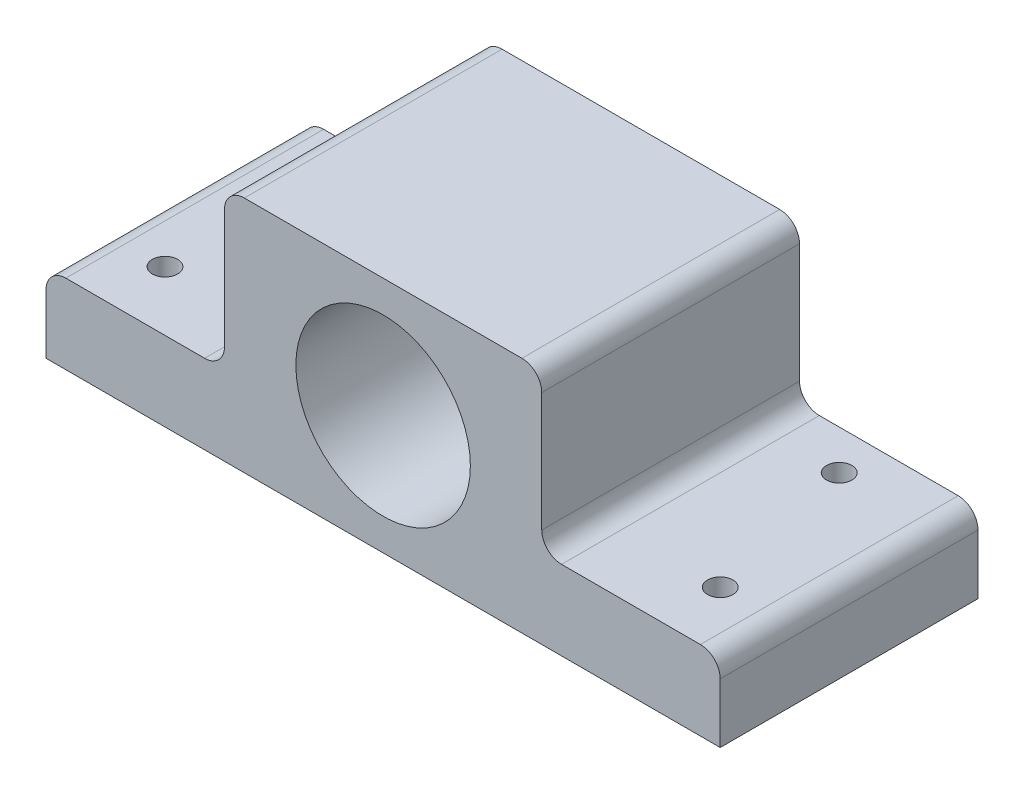
from build123d import *

# Parameters (mm, degrees)
BOSS_EXTRUDE1_DEPTH      = 15
BOSS_EXTRUDE1_DEPTH_BACK = 17.5
SKETCH2_R                = 11
CUT_EXTRUDE1_DEPTH       = 92.821838361
CUT_EXTRUDE1_DEPTH_BACK  = 92.821838361
SKETCH3_R                = 1.6
FILLET1_R                = 2.5


with BuildPart() as part:
    # Sketch2 → Boss-Extrude1 (new, two sides: drawn at the far end of the back side and taken through both)
    with BuildSketch(Plane.XY.offset(-BOSS_EXTRUDE1_DEPTH_BACK)):
        Polygon((0, 10), (0, 0), (85, 0), (85, 10), (62.5, 10), (62.5, 30), (22.5, 30), (22.5, 10), align=None)
        with Locations((42.5, 15)):
            Circle(SKETCH2_R, mode=Mode.SUBTRACT)
    extrude(amount=BOSS_EXTRUDE1_DEPTH + BOSS_EXTRUDE1_DEPTH_BACK)

    # Sketch3 → Cut-Extrude1 (cut, two sides: drawn at the far end of the back side and taken through both)
    with BuildSketch(Plane(origin=(0, 0, 0), x_dir=(1, 0, 0), z_dir=(0, 1, 0)).offset(-CUT_EXTRUDE1_DEPTH_BACK)):
        with Locations((7.5, -7.5)):
            Circle(SKETCH3_R)
        with Locations((77.5, -7.5)):
            Circle(SKETCH3_R)
        with Locations((72.5, 12.5)):
            Circle(SKETCH3_R)
        with Locations((12.5, 12.5)):
            Circle(SKETCH3_R)
    extrude(amount=CUT_EXTRUDE1_DEPTH + CUT_EXTRUDE1_DEPTH_BACK, mode=Mode.SUBTRACT)

    # Fillet1
    fillet1_edges = [part.edges().sort_by_distance(p)[0] for p in [
        (62.5, 10, -1.25),
        (22.5, 10, -1.25),
        (85, 10, -1.25),
        (0, 10, -1.25),
        (62.5, 30, -1.25),
        (22.5, 30, -1.25),
    ]]
    fillet(fillet1_edges, radius=FILLET1_R)


solid = part.part
